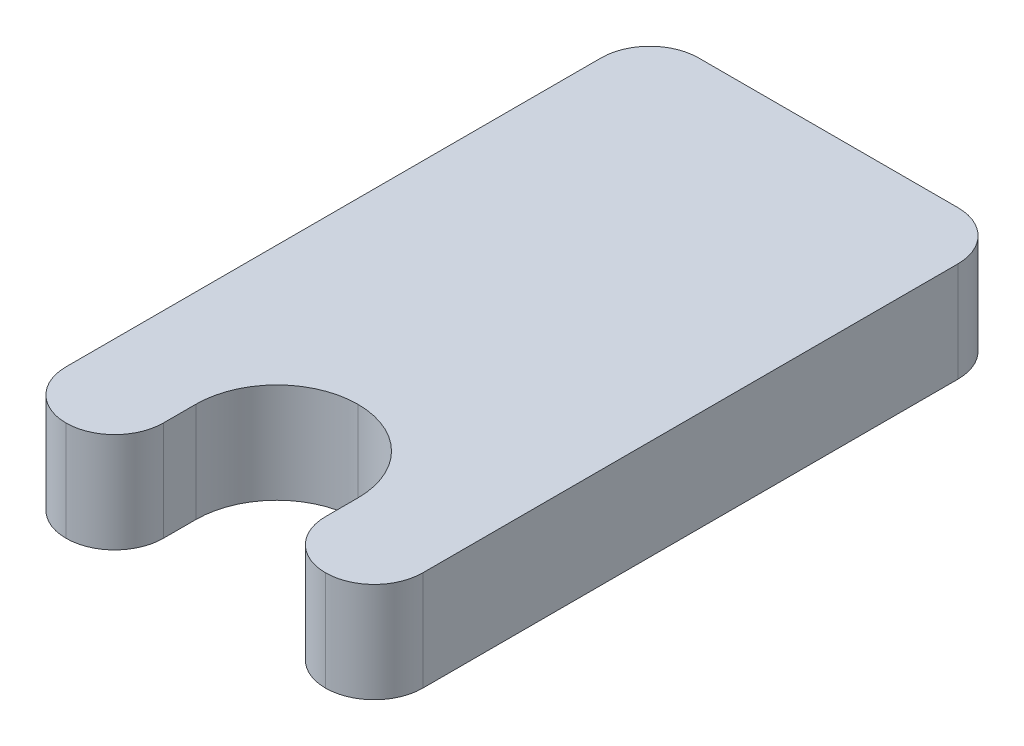
from build123d import *

# Parameters (mm, degrees)
BOSS_EXTRUDE1_DEPTH = 3.08
FILLET1_R           = 2.5
FILLET2_R           = 1.5


with BuildPart() as part:
    # Sketch2 → Boss-Extrude1 (new body)
    with BuildSketch(Plane(origin=(0, 0, 0), x_dir=(1, 0, 0), z_dir=(0, 1, 0))):
        Polygon((-2.5, 2.5), (-2.5, -2.5), (-5.5, -2.5), (-5.5, 17), (5.5, 17), (5.5, -2.5), (2.5, -2.5), (2.5, 2.5), align=None)
    extrude(amount=BOSS_EXTRUDE1_DEPTH)

    # Fillet1
    fillet1_edges = [part.edges().sort_by_distance(p)[0] for p in [
        (-2.5, 1.54, -2.5),
        (2.5, 1.54, -2.5),
    ]]
    fillet(fillet1_edges, radius=FILLET1_R - 0.0001)  # a hair under: the kernel refuses the full size

    # Fillet2
    fillet2_edges = [part.edges().sort_by_distance(p)[0] for p in [
        (-5.5, 1.54, -17),
        (5.5, 1.54, -17),
        (5.5, 1.54, 2.5),
        (2.5, 1.54, 2.5),
        (-5.5, 1.54, 2.5),
        (-2.5, 1.54, 2.5),
    ]]
    fillet(fillet2_edges, radius=FILLET2_R - 0.0001)  # a hair under: the kernel refuses the full size


solid = part.part
